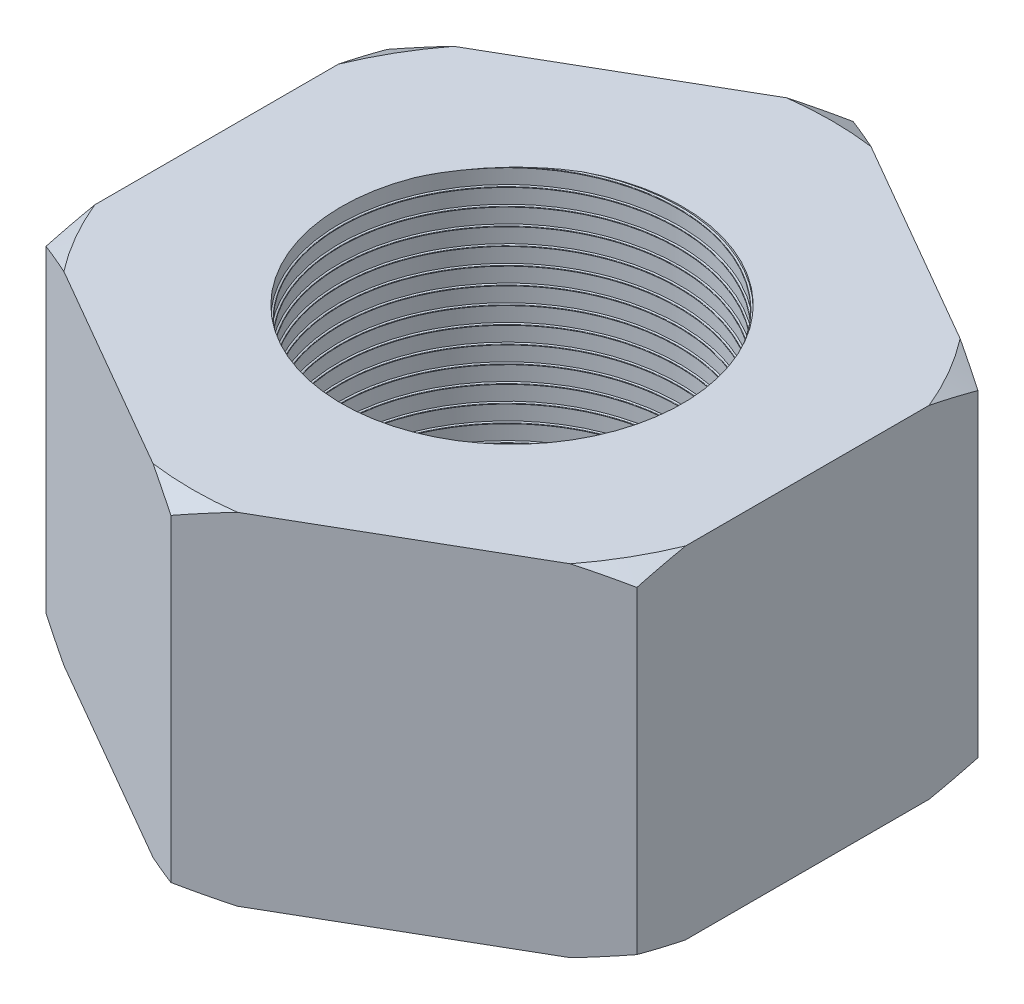
from build123d import *

# Parameters (mm, degrees)
BOSS_EXTRUDE1_DEPTH = 20
SKETCH3_R           = 10
CUT_EXTRUDE1_DEPTH  = 20
SWEEP1_PITCH        = 1
SWEEP1_FROM         = 0
SWEEP1_TO           = 20


with BuildPart() as part:
    # Sketch1 → Boss-Extrude1 (new body)
    with BuildSketch(Plane(origin=(0, 0, 0), x_dir=(1, 0, 0), z_dir=(0, 1, 0))):
        Polygon((0, -20), (17.320508076, -10), (17.320508076, 10), (0, 20), (-17.320508076, 10), (-17.320508076, -10), align=None)
    extrude(amount=BOSS_EXTRUDE1_DEPTH)

    # Sketch3 → Cut-Extrude1 (cut)
    with BuildSketch(Plane(origin=(0, 20, 0), x_dir=(1, 0, 0), z_dir=(0, 1, 0))):
        with Locations(Location((0, 0, 0), (0, 0, 270))):
            Circle(SKETCH3_R)
    extrude(amount=-CUT_EXTRUDE1_DEPTH, mode=Mode.SUBTRACT)

    # Sketch5 → Cut-Revolve1 (revolve, cut)
    with BuildSketch(Plane(origin=(0, 0, 0), x_dir=(0, 0, -1), z_dir=(1, 0, 0))):
        Polygon((18.386499621, 20.765430863), (22.138795425, 20.765430863), (22.138795425, 18.171452459), (17.309753868, 20.765430863), align=None)
        Polygon((17.309753868, -0.765430863), (18.386499621, -0.765430863), (22.138795425, -0.765430863), (22.138795425, 1.828547541), align=None)
    revolve(axis=Axis((0, 23.294985771, 0), (0, -1, 0)), mode=Mode.SUBTRACT)

    # Sweep1: arcs per turn and ends read off the stored shape
    # Sweep1: the profile of Sketch9 screwed along a right-hand helix through 21.5 turns, 8 arcs to a turn; built about Z, then put on its axis
    sweep1_z = Axis((0, 0, 0), (0, 0, 1))
    sweep1_corners = [(10.031453607, 0, -1.058121514), (10.031453607, 0, -0.921971854), (9.910291108, 0, -0.967262353), (9.894213155, 0, -0.990217118), (9.909869226, 0, -1.013461671)]
    with BuildLine(mode=Mode.PRIVATE) as sweep1_profile:
        Line(sweep1_corners[0], sweep1_corners[1])
        Line(sweep1_corners[1], sweep1_corners[2])
        Line(sweep1_corners[4], sweep1_corners[0])
        ThreePointArc((9.910291108, 0, -0.967262353), (9.898689964, 0, -0.976244726), (9.894213155, 0, -0.990217118))
        ThreePointArc((9.894213155, 0, -0.990217118), (9.898434053, 0, -1.004268935), (9.909869226, 0, -1.013461671))
    sweep1_cap = Face(sweep1_profile.wire())
    sweep1_arcs = [((9.910291108, 0, -0.967262353), (9.894368389, 0, -0.973217812), (9.894213155, 0, -0.990217118), (1, 0.8242751320057563, 1)), ((9.894213155, 0, -0.990217118), (9.894057921, 0, -1.007216423), (9.909869226, 0, -1.013461671), (1, 0.8242751320057563, 1))]  # start, shoulder, end, weights
    sweep1_turn_angles = [0, 22.5, 45, 67.5, 90, 112.5, 135, 157.5, 180, 202.5, 225, 247.5, 270, 292.5, 315, 337.5, 360]
    sweep1_turn_weights = [1, 0.9238795325112867, 1, 0.9238795325112867, 1, 0.9238795325112867, 1, 0.9238795325112867, 1, 0.9238795325112867, 1, 0.9238795325112867, 1, 0.9238795325112867, 1, 0.9238795325112867, 1]
    sweep1_turn_rails = [Edge.make_bspline([Vector(p[0], p[1], 0).rotate(sweep1_z, sweep1_turn_angles[k]) / sweep1_turn_weights[k] + Vector(0, 0, p[2] + SWEEP1_PITCH * sweep1_turn_angles[k] / 360) for k in range(17)], [0, 0, 0, 1, 1, 2, 2, 3, 3, 4, 4, 5, 5, 6, 6, 7, 7, 8, 8, 8], 2, sweep1_turn_weights) for p in sweep1_corners]
    sweep1_turn_sides = [*[Face.make_surface_from_curves(sweep1_turn_rails[p[0]], sweep1_turn_rails[p[1]]) for p in [(0, 1), (1, 2), (4, 0)]], *[Face.make_bezier_surface([[Vector(p[j][0], p[j][1], 0).rotate(sweep1_z, sweep1_turn_angles[2 * i + k]) / sweep1_turn_weights[2 * i + k] + Vector(0, 0, p[j][2] + SWEEP1_PITCH * sweep1_turn_angles[2 * i + k] / 360) for k in range(3)] for j in range(3)], [[p[3][j] * sweep1_turn_weights[2 * i + k] for k in range(3)] for j in range(3)]) for p in sweep1_arcs for i in range(8)]]
    sweep1_last_angles = [7560, 7582.5, 7605, 7627.5, 7650, 7672.5, 7695, 7717.5, 7740]
    sweep1_last_weights = [1, 0.9238795325112867, 1, 0.9238795325112867, 1, 0.9238795325112867, 1, 0.9238795325112867, 1]
    sweep1_last_rails = [Edge.make_bspline([Vector(p[0], p[1], 0).rotate(sweep1_z, sweep1_last_angles[k]) / sweep1_last_weights[k] + Vector(0, 0, p[2] + SWEEP1_PITCH * sweep1_last_angles[k] / 360) for k in range(9)], [0, 0, 0, 1, 1, 2, 2, 3, 3, 4, 4, 4], 2, sweep1_last_weights) for p in sweep1_corners]
    sweep1_last_sides = [*[Face.make_surface_from_curves(sweep1_last_rails[p[0]], sweep1_last_rails[p[1]]) for p in [(0, 1), (1, 2), (4, 0)]], *[Face.make_bezier_surface([[Vector(p[j][0], p[j][1], 0).rotate(sweep1_z, sweep1_last_angles[2 * i + k]) / sweep1_last_weights[2 * i + k] + Vector(0, 0, p[j][2] + SWEEP1_PITCH * sweep1_last_angles[2 * i + k] / 360) for k in range(3)] for j in range(3)], [[p[3][j] * sweep1_last_weights[2 * i + k] for k in range(3)] for j in range(3)]) for p in sweep1_arcs for i in range(4)]]
    sweep1 = Plane(origin=(0, 20, 0), x_dir=(-0.7071067811865537, 0, -0.7071067811865414), z_dir=(0, -1, 0)) * split(split(Solid(Shell([*[p.moved(Location((0, 0, SWEEP1_PITCH * i))) for i in range(21) for p in sweep1_turn_sides], *sweep1_last_sides, sweep1_cap, sweep1_cap.rotate(sweep1_z, 7740).moved(Location((0, 0, SWEEP1_PITCH * 7740 / 360)))])), bisect_by=Plane.XY.offset(SWEEP1_FROM), keep=Keep.TOP, mode=Mode.PRIVATE), bisect_by=Plane.XY.offset(SWEEP1_TO), keep=Keep.BOTTOM, mode=Mode.PRIVATE)
    add(sweep1)


solid = part.part
